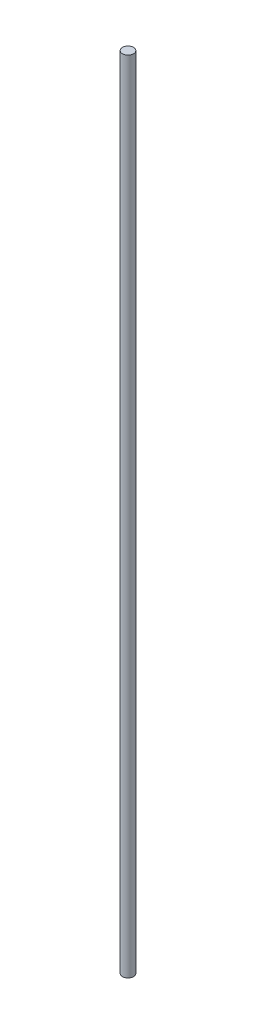
from build123d import *

# Parameters (mm, degrees)
SKETCH1_R           = 6.35
BOSS_EXTRUDE1_DEPTH = 914.4


with BuildPart() as part:
    # Sketch1 → Boss-Extrude1 (new body)
    with BuildSketch(Plane(origin=(0, 0, 0), x_dir=(1, 0, 0), z_dir=(0, 1, 0))):
        Circle(SKETCH1_R)
    extrude(amount=BOSS_EXTRUDE1_DEPTH)


solid = part.part
